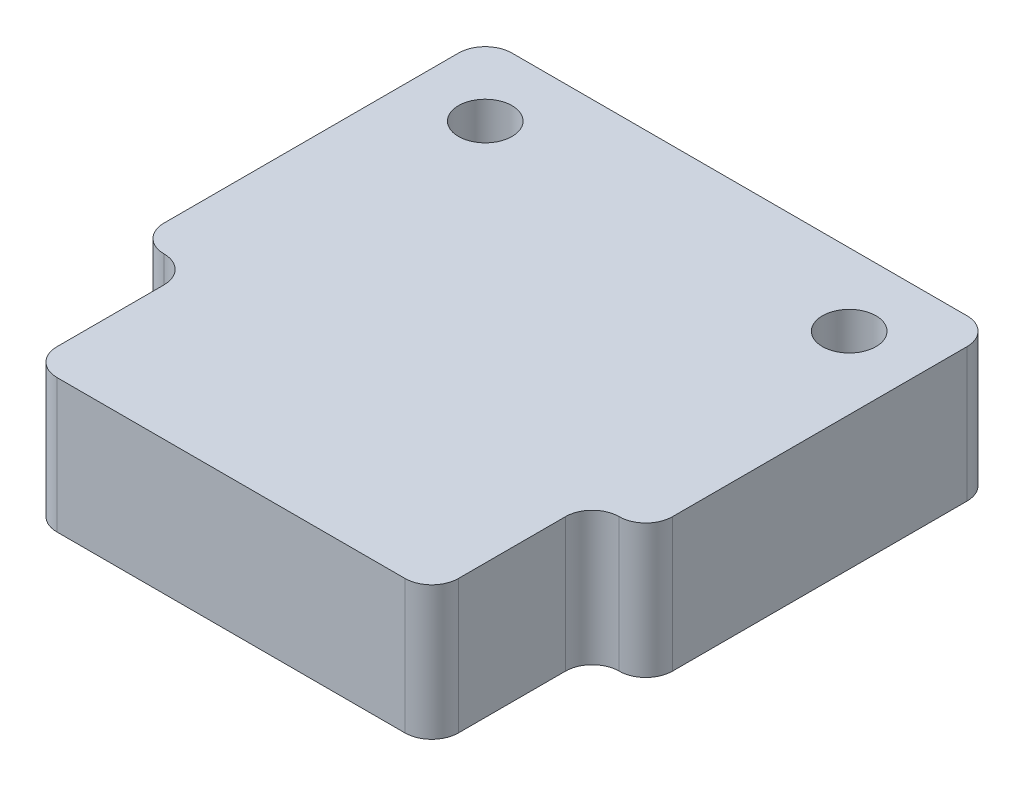
from build123d import *

# Parameters (mm, degrees)
ESQUISSE2_R        = 1
BOSS_EXTRU_1_DEPTH = 5
CONG_1_R           = 1


with BuildPart() as part:
    # Esquisse2 → Boss.-Extru.1 (new body)
    with BuildSketch(Plane(origin=(0, 0, 0), x_dir=(1, 0, 0), z_dir=(0, 1, 0))):
        Polygon((-9.5, -3.5), (-9.5, 9.5), (9.5, 9.5), (9.5, -3.5), (7.5, -3.5), (7.5, -9.5), (-7.5, -9.5), (-7.5, -3.5), align=None)
        with Locations(Location((-6.8, 6.8, 0), (0, 0, 270))):
            Circle(ESQUISSE2_R, mode=Mode.SUBTRACT)
        with Locations(Location((6.8, 6.8, 0), (0, 0, 90))):
            Circle(ESQUISSE2_R, mode=Mode.SUBTRACT)
    extrude(amount=BOSS_EXTRU_1_DEPTH)

    # Congé1
    cong_1_edges = [part.edges().sort_by_distance(p)[0] for p in [
        (9.5, 2.5, -9.5),
        (9.5, 2.5, 3.5),
        (7.5, 2.5, 3.5),
        (7.5, 2.5, 9.5),
        (-7.5, 2.5, 9.5),
        (-7.5, 2.5, 3.5),
        (-9.5, 2.5, 3.5),
        (-9.5, 2.5, -9.5),
    ]]
    fillet(cong_1_edges, radius=CONG_1_R - 0.0001)  # a hair under: the kernel refuses the full size


solid = part.part
